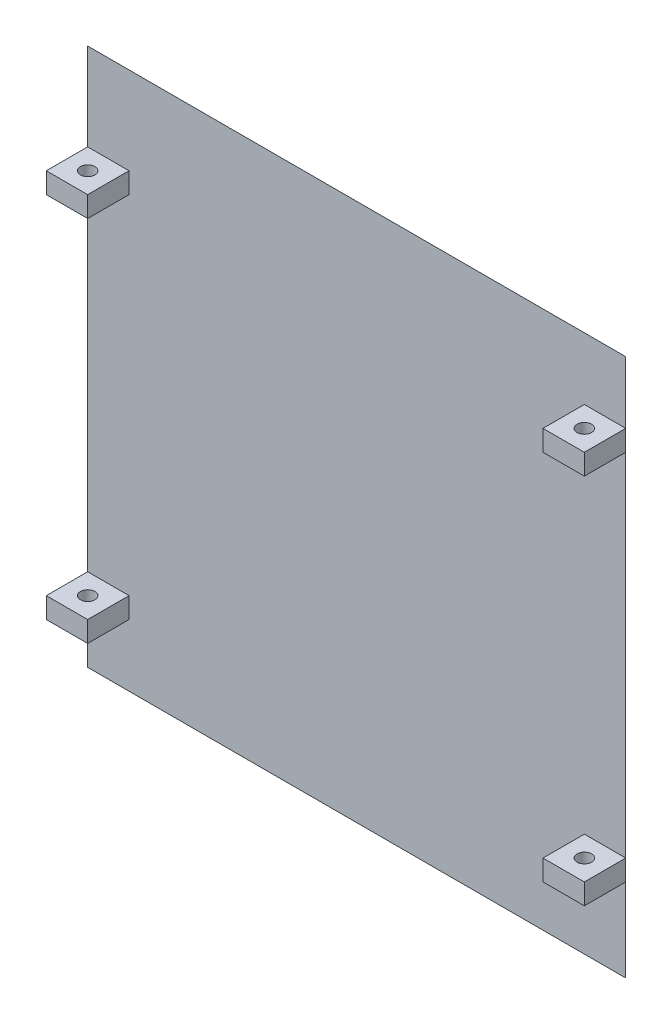
from build123d import *

# Parameters (mm, degrees)
ESQUISSE1_W             = 130
ESQUISSE1_H             = 130
BOSS_EXTRU_1_DEPTH      = 3
CHANFREIN1_SIZE         = 3
ESQUISSE2_W             = 10
ESQUISSE2_H             = 5
BOSS_EXTRU_2_DEPTH      = 10
ESQUISSE4_R             = 1.75
ENL_V_MAT_EXTRU_1_DEPTH = 175.051716452
ESQUISSE5_R             = 1.75
ENL_V_MAT_EXTRU_2_DEPTH = 171.724954239
ENL_V_MAT_EXTRU_3_DEPTH = 2.6


with BuildPart() as part:
    # Esquisse1 → Boss.-Extru.1 (new body)
    with BuildSketch(Plane.XY):
        with Locations((65, 65)):
            Rectangle(ESQUISSE1_W, ESQUISSE1_H)
    extrude(amount=BOSS_EXTRU_1_DEPTH)

    # Chanfrein1
    chanfrein1_edges = [part.edges().sort_by_distance(p)[0] for p in [
        (65, 130, 0),
        (130, 65, 0),
        (65, 0, 0),
        (0, 65, 0),
    ]]
    chamfer(chanfrein1_edges, length=CHANFREIN1_SIZE - 0.0001)  # a hair under: the kernel refuses the full size

    # Esquisse2 → Boss.-Extru.2 (add)
    with BuildSketch(Plane.XY.offset(3)):
        with Locations((5, 106.4)):
            Rectangle(ESQUISSE2_W, ESQUISSE2_H)
        with Locations((5, 17.5)):
            Rectangle(ESQUISSE2_W, ESQUISSE2_H)
        with Locations((125, 22.6)):
            Rectangle(ESQUISSE2_W, ESQUISSE2_H)
        with Locations((125, 112.5)):
            Rectangle(ESQUISSE2_W, ESQUISSE2_H)
    extrude(amount=BOSS_EXTRU_2_DEPTH)

    # Esquisse4 → Enlèv. mat.-Extru.1 (cut, through all)
    with BuildSketch(Plane.XZ.offset(-15)):
        with Locations(Location((5, 8, 0), (0, 0, 270))):
            Circle(ESQUISSE4_R)
    extrude(amount=-ENL_V_MAT_EXTRU_1_DEPTH, mode=Mode.SUBTRACT)

    # Esquisse5 → Enlèv. mat.-Extru.2 (cut, through all)
    with BuildSketch(Plane.XZ.offset(-20.1)):
        with Locations(Location((125, 8, 0), (0, 0, 270))):
            Circle(ESQUISSE5_R)
    extrude(amount=-ENL_V_MAT_EXTRU_2_DEPTH, mode=Mode.SUBTRACT)

    # Esquisse6 → Enlèv. mat.-Extru.3 (cut)
    with BuildSketch(Plane(origin=(0, 0, 0), x_dir=(-1, 0, 0), z_dir=(0, 0, -1))):
        with BuildLine():
            add(Edge.make_bspline(
                [(-52.26076236, 57.842110663), (-49.638430081, 61.827223808), (-44.831263007, 69.615067988), (-48.872816264, 80.144983064), (-54.907098012, 83.543706055), (-60.993121935, 84.979994994), (-64.02669589, 86.077968343), (-73.230775984, 84.96878426), (-69.042541446, 86.029870044), (-67.342173336, 86.249572632), (-60.157506515, 85.721576011), (-64.318579507, 86.476246071), (-66.44227062, 86.333633699), (-70.107500201, 86.443134198), (-74.906109433, 86.010269777), (-83.380297016, 84.576538019), (-94.161820704, 79.701568766), (-96.756222119, 78.543497127), (-98.250577175, 78.108012812), (-98.958484079, 77.657108819), (-99.852556484, 77.552547756), (-101.84649828, 77.608938753), (-103.500751729, 75.529676874), (-107.172137554, 74.47484289), (-108.962805769, 73.661142231), (-110.360165523, 72.703820988), (-110.331872447, 73.766833038), (-109.396715094, 73.719356163), (-107.915536031, 74.744164219), (-106.843102282, 74.997132338), (-105.282950753, 75.866867669), (-105.689090509, 75.987025882), (-106.080336541, 75.611710725), (-105.913565735, 75.903175529), (-105.842125236, 76.020600111), (-105.83894606, 76.025811308)],
                knots=[0, 0, 0, 0, 0.034118173, 0.050236448, 0.068967481, 0.073500141, 0.095563045, 0.104190877, 0.107921759, 0.116908237, 0.126964302, 0.130310205, 0.137621374, 0.144820214, 0.154992728, 0.171421939, 0.207781336, 0.216895984, 0.219190241, 0.229442387, 0.232264538, 0.246130236, 0.386672642, 0.489153724, 0.601852187, 0.608768219, 0.628383974, 0.656973958, 0.68694343, 0.800374789, 0.80697629, 0.814481946, 0.827884702, 0.837106078, 0.837535097, 0.837535097, 0.837535097, 0.837535097], degree=3))
            add(Edge.make_bspline(
                [(-105.83894606, 76.025811308), (-100.611764863, 77.915501842), (-100.270184629, 80.516089176), (-93.248245798, 82.141795879), (-93.563802694, 82.574332788), (-93.967817384, 82.336835746), (-94.820785701, 81.809365773), (-97.601379966, 80.896394595), (-101.598242168, 79.222110985), (-106.319468241, 76.866785477), (-108.770133815, 75.840096768), (-110.334374265, 74.79423189), (-110.31409303, 75.436146755), (-109.808523188, 75.437982404), (-109.320639131, 75.939424135), (-108.274867033, 76.21195993), (-107.159091736, 77.053055725), (-105.921775344, 77.554930425), (-105.313901373, 77.963721878), (-104.818401125, 78.201934788), (-105.230994494, 78.520268255), (-105.461196969, 78.180115154), (-105.73871299, 77.968708809), (-106.080968203, 78.214223857), (-105.61019121, 78.285780081), (-105.329728161, 78.588385547), (-104.493211976, 78.886306632), (-103.493043665, 79.664658124), (-102.309796852, 80.298826171), (-101.55169999, 80.579680027), (-101.244906335, 80.976434405), (-102.034747545, 80.857008546), (-102.381757943, 80.324053226), (-103.387591265, 80.034603286), (-103.779162656, 79.539320968), (-104.261641478, 79.522763735), (-104.13114329, 79.934090928), (-103.630948631, 80.014202778), (-103.050169165, 80.517294832), (-101.472592842, 81.893737732), (-96.448714183, 84.774176995), (-84.930707293, 90.591691401), (-71.956131087, 93.446049169), (-62.886374836, 94.063630887), (-61.083433219, 94.141953378), (-60.886957322, 94.17909639), (-60.643329122, 94.362343433), (-61.115438899, 94.526935707), (-61.637349256, 94.308991085), (-62.39928475, 94.35214762), (-62.685624848, 94.319108378)],
                knots=[0, 0, 0, 0, 0.134847579, 0.143034237, 0.144601639, 0.148638772, 0.154180377, 0.178067515, 0.234677611, 0.292201023, 0.330745501, 0.333193175, 0.337239427, 0.34163035, 0.346584802, 0.358071859, 0.373748347, 0.389768442, 0.396912852, 0.399366253, 0.402749079, 0.40598643, 0.410304005, 0.412055835, 0.415102654, 0.419095224, 0.426513149, 0.440578697, 0.458947906, 0.465949143, 0.46750081, 0.470952025, 0.480463688, 0.491216585, 0.499184075, 0.500837468, 0.502285256, 0.509315764, 0.515195501, 0.525664095, 0.573905162, 0.691976912, 0.92332858, 0.972552013, 0.974530944, 0.977935359, 0.979470166, 0.981332426, 0.988581693, 1, 1, 1, 1], degree=3))
            add(Edge.make_bspline(
                [(-62.685624848, 94.319108378), (-62.699460138, 94.331836845), (-64.788443443, 94.231418891), (-65.852390177, 94.027923896), (-66.036935707, 94.122467876), (-65.908609138, 94.403631121), (-65.79797808, 94.389643295), (-65.621640786, 94.389643295)],
                knots=[0, 0, 0, 0, 0.789100761, 0.825841685, 0.866784773, 0.917493908, 1, 1, 1, 1], degree=3))
            add(Edge.make_bspline(
                [(-65.621640786, 94.389643295), (-63.258463913, 94.670389417), (-59.495036105, 95.187522468), (-52.082726145, 94.244223553), (-43.705721267, 92.250679636), (-37.217902945, 83.719993536), (-37.285537884, 77.160176486), (-37.301347049, 71.769326523), (-39.13638437, 68.984147818), (-39.872866659, 66.516897349), (-39.328743103, 65.30752977), (-41.059513496, 63.912064827), (-42.455906484, 61.798094223), (-43.633276075, 60.22601034), (-45.948812181, 58.463754093), (-41.879556405, 58.978593854), (-38.748044117, 58.273663142), (-32.431776044, 56.841077917), (-24.560362389, 47.563458306), (-31.27164611, 29.077210606), (-45.06887719, 18.030298608), (-54.470751287, 12.025254746), (-59.203356718, 10.218833798), (-60.491772172, 10.393968721), (-61.951535689, 10.369112242), (-65.70146114, 10.100158597), (-62.721617551, 10.926419225), (-60.426236881, 12.560459653), (-54.806694167, 15.188446413), (-46.935738775, 20.553867821), (-38.085230403, 28.418564315), (-33.53128, 36.617229375), (-31.878219143, 43.572770361), (-35.516020079, 45.713720411), (-37.64032532, 46.921380077), (-40.940910434, 46.40420911), (-40.77841657, 47.528156732), (-40.889045883, 48.472355353), (-43.39771772, 47.663690915), (-46.242656042, 49.170442477), (-50.676824568, 48.179474148), (-53.578703927, 48.552563413), (-55.410792303, 47.734672761), (-55.930342517, 48.630700523), (-54.727524319, 48.536782692), (-53.396833079, 48.548944662), (-54.308995697, 49.435651948), (-55.209579327, 48.688458843), (-57.112338512, 49.110762159), (-58.407329866, 46.542335065), (-61.451667884, 46.153514365), (-63.76168886, 43.121809579), (-68.061103672, 42.164456068), (-72.472141972, 39.102431935), (-74.934574826, 38.410527903), (-78.630813362, 35.624519293), (-78.328796883, 37.044638871), (-77.260060223, 37.02184234), (-76.394327643, 37.942371848), (-75.254985047, 38.552153781), (-73.942523076, 38.982518606), (-73.135868133, 40.26800776), (-71.325498879, 40.768221652), (-69.44220103, 41.837548865), (-68.487577885, 42.740012627), (-66.785288378, 43.836124543), (-68.363640892, 43.294453829), (-68.858599988, 42.567593749), (-70.297363286, 41.801457625), (-71.595224547, 40.838363412), (-73.468650933, 40.258888633), (-75.876492893, 38.838770769), (-76.966859294, 37.312666646), (-79.301536748, 36.943105131), (-78.985716478, 37.300198673), (-78.979202871, 37.215874272), (-78.682178127, 37.352567542)],
                knots=[0, 0, 0, 0, 0.026687041, 0.041758511, 0.083493474, 0.118973002, 0.150540371, 0.156597534, 0.176994959, 0.18017269, 0.185825157, 0.191479594, 0.201603433, 0.213817923, 0.218106659, 0.223795932, 0.242243458, 0.266099554, 0.288781538, 0.369710272, 0.440444573, 0.490023006, 0.491708173, 0.496504241, 0.503315345, 0.512757585, 0.517466541, 0.527117388, 0.549027526, 0.582504712, 0.63508691, 0.675369094, 0.692163791, 0.702025976, 0.717110337, 0.724426756, 0.726291893, 0.728748425, 0.733278045, 0.748050913, 0.765920834, 0.779574845, 0.782783307, 0.784336954, 0.788151912, 0.791966871, 0.79347413, 0.798862712, 0.802060091, 0.813838189, 0.823241002, 0.834393423, 0.85328146, 0.871386034, 0.888313364, 0.896675766, 0.89777436, 0.902184864, 0.905808952, 0.91165869, 0.916425933, 0.920642695, 0.927542642, 0.936656222, 0.942844494, 0.946607064, 0.949757772, 0.954208113, 0.957935126, 0.967061389, 0.972245786, 0.979627044, 0.996876113, 0.997505843, 0.998262685, 1, 1, 1, 1], degree=3))
            add(Edge.make_bspline(
                [(-78.682178127, 37.352567542), (-78.64653072, 37.519751891), (-78.890098941, 37.390033465), (-79.240614822, 37.422257615), (-78.875037965, 37.735843863), (-78.449564564, 38.012909453), (-77.406116855, 38.585836995), (-76.049102465, 39.869558506), (-73.342687107, 42.222268025), (-69.780543162, 44.668234907), (-65.755578783, 45.690161571), (-65.014010104, 47.015645006), (-64.910730598, 47.186880804), (-65.356742071, 47.292549505), (-65.683146529, 46.972240108), (-66.44902004, 46.879064449), (-67.29525466, 46.827548519), (-68.351052039, 47.219618282), (-69.525717729, 47.308617728), (-72.164746163, 46.929332332), (-75.512687446, 45.870799209), (-79.67746514, 44.111274589), (-82.622988629, 42.970227173), (-84.546873641, 42.116953906), (-85.064773051, 41.266639025), (-86.013992616, 41.504532534), (-86.819453603, 40.977760196), (-87.956136362, 40.776469073), (-88.880923865, 40.266960874), (-90.014808254, 40.13440085), (-90.834745667, 39.583222097), (-91.725058942, 39.384819984), (-92.649287537, 39.434198128), (-92.913685356, 40.437298403), (-92.023486027, 41.4238953), (-90.65490894, 42.951642322), (-87.538775011, 44.44684431), (-83.869280142, 45.976904311), (-80.504136538, 48.926633368), (-77.001773377, 49.920144068), (-74.084770643, 51.501350532), (-72.203264396, 51.573425473), (-70.710646456, 52.9268648), (-70.370616443, 52.170463429), (-70.953261415, 51.580425779), (-69.651067362, 52.020605003), (-69.008313913, 52.460164156), (-67.82213612, 53.30208229), (-66.480065787, 53.69279819), (-65.096831347, 53.944870069), (-64.630153754, 55.14274515), (-63.525892547, 54.891086239), (-62.378346051, 55.417589106), (-60.933250848, 56.518983652), (-58.412386109, 56.679450076), (-55.499834386, 57.360850331), (-53.364422003, 57.417805174), (-52.26076236, 57.842110663)],
                knots=[0, 0, 0, 0, 0.003834771, 0.005625769, 0.008650413, 0.013337213, 0.025484996, 0.043793879, 0.074034413, 0.138519412, 0.186487406, 0.188035725, 0.189270321, 0.191768902, 0.197818485, 0.204073543, 0.21530722, 0.224788642, 0.239449454, 0.252378597, 0.309642938, 0.350812124, 0.396294991, 0.411558776, 0.416284588, 0.425569842, 0.43728448, 0.446181137, 0.462020104, 0.470349452, 0.482049517, 0.492444261, 0.500051468, 0.507957674, 0.519114075, 0.539936082, 0.57420713, 0.626741522, 0.66709193, 0.713692614, 0.742757768, 0.767935224, 0.78126626, 0.7848311, 0.790075173, 0.797680908, 0.809788701, 0.82317486, 0.840569523, 0.856115471, 0.863527385, 0.876385841, 0.884884293, 0.903946939, 0.932867387, 0.962688937, 1, 1, 1, 1], degree=3))
        make_face()
    extrude(amount=-ENL_V_MAT_EXTRU_3_DEPTH, mode=Mode.SUBTRACT)


solid = part.part
